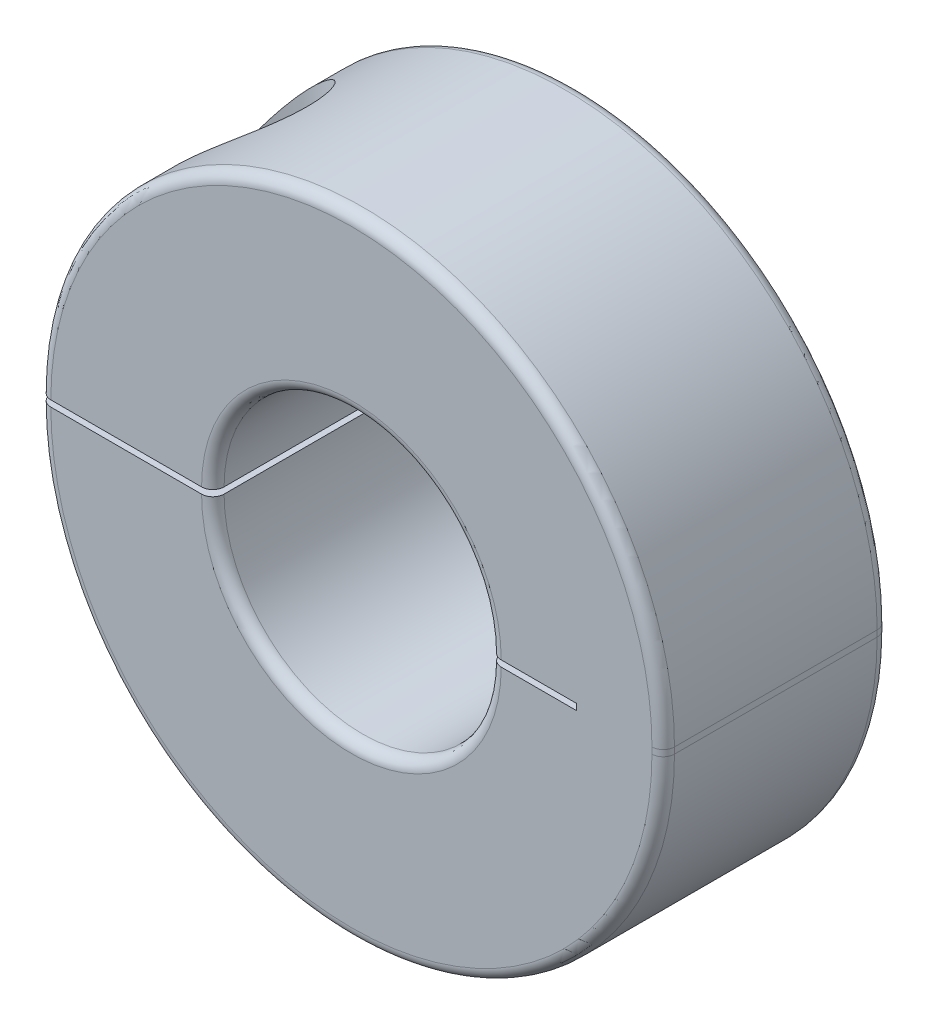
from build123d import *

# Parameters (mm, degrees)
EXTRUDE1_DEPTH     = 5.159375
CUT_EXTRUDE2_DEPTH = 2.0828
FILLET1_R          = 0.5159375
FILLET2_R          = 0.5159375
CHAMFER2_SIZE      = 0.254


with BuildPart() as part:
    # Sketch1 → Extrude1 (new, symmetric)
    with BuildSketch(Plane.XY):
        with BuildLine():
            Line((-14.2875, 0.142875), (-6.35, 0.142875))
            ThreePointArc((-6.35, 0.142875), (0, 6.492875), (6.35, 0.142875))
            Line((6.35, 0.142875), (10.31875, 0.142875))
            Line((10.31875, 0.142875), (10.31875, -0.142875))
            Line((10.31875, -0.142875), (6.35, -0.142875))
            ThreePointArc((6.35, -0.142875), (0, -6.492875), (-6.35, -0.142875))
            Line((-6.35, -0.142875), (-14.2875, -0.142875))
            ThreePointArc((-14.2875, -0.142875), (0, -14.430375), (14.2875, -0.142875))
            Line((14.2875, -0.142875), (14.2875, 0.142875))
            ThreePointArc((14.2875, 0.142875), (0, 14.430375), (-14.2875, 0.142875))
        make_face()
    extrude(amount=EXTRUDE1_DEPTH, both=True)

    # Sketch4 → Cut-Revolve1 (revolve, cut)
    with BuildSketch(Plane.XY):
        Polygon((-10.31875, 14.430375), (-7.19455, 14.430375), (-7.19455, 2.225675), (-8.23595, 2.225675), (-8.23595, -14.430375), (-10.31875, -14.430375), align=None)
    revolve(axis=Axis((-10.31875, -14.430375, 0), (0, 1, 0)), mode=Mode.SUBTRACT)

    # Fillet1
    fillet1_edges = [part.edges().sort_by_distance(p)[0] for p in [
        (0, 6.492875, -5.159375),
        (0, 6.492875, 5.159375),
        (0, 14.430375, -5.159375),
        (0, 14.430375, 5.159375),
        (0, -14.430375, -5.159375),
        (0, -14.430375, 5.159375),
        (14.2875, 0, -5.159375),
        (14.2875, 0, 5.159375),
    ]]
    fillet(fillet1_edges, radius=FILLET1_R)

    # Fillet2
    fillet2_edges = [part.edges().sort_by_distance(p)[0] for p in [
        (0, -6.492875, -5.159375),
        (0, -6.492875, 5.159375),
    ]]
    fillet(fillet2_edges, radius=FILLET2_R)


with BuildPart() as body_2:
    # Sketch6 → Revolve1 (revolve)
    with BuildSketch(Plane.XY):
        Polygon((-10.31875, 6.391275), (-7.19455, 6.391275), (-7.19455, 2.225675), (-8.23595, 2.225675), (-8.23595, -6.105525), (-10.31875, -6.105525), align=None)
    revolve(axis=Axis((-10.31875, -6.105525, 0), (0, 1, 0)))

    # Sketch7 → Cut-Extrude2 (cut)
    with BuildSketch(Plane(origin=(0, 6.391275, 0), x_dir=(-1, 0, 0), z_dir=(0, 1, 0))):
        Polygon((10.31875, -1.924008225), (11.98499, -0.962004113), (11.98499, 0.962004113), (10.31875, 1.924008225), (8.65251, 0.962004113), (8.65251, -0.962004113), align=None)
    extrude(amount=-CUT_EXTRUDE2_DEPTH, mode=Mode.SUBTRACT)

    # Chamfer2
    chamfer2_edges = [body_2.edges().sort_by_distance(p)[0] for p in [
        (-13.44295, 6.391275, 0),
    ]]
    chamfer(chamfer2_edges, length=CHAMFER2_SIZE)


solid = Compound([part.part, body_2.part])
